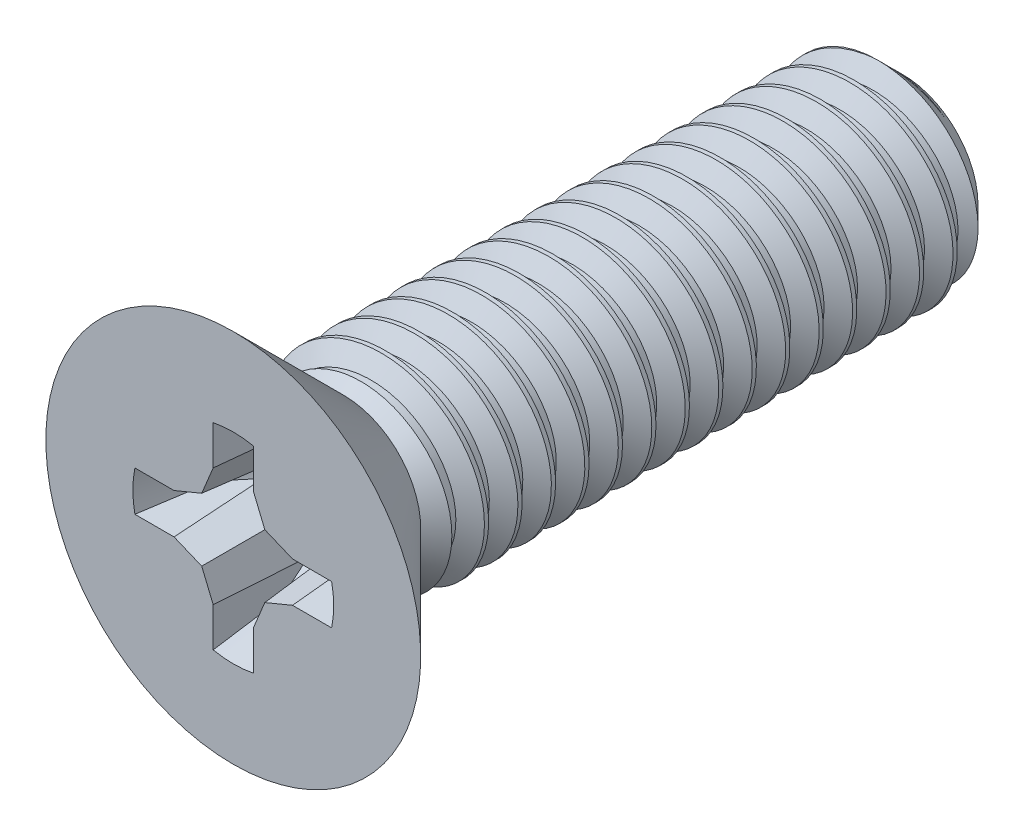
from build123d import *

# Parameters (mm, degrees)
HEAD_DIAMETER_SKETCH_R = 2.8
HEAD_EXTRUDE_DEPTH     = 1.65
SHAFT_SKETCH_W         = 8.35
SHAFT_SKETCH_H         = 1.5
THREAD_PITCH           = 0.5
DRIVE_CUT_REACH        = 12.755
DRIVE_PATTERN_COUNT    = 4
DRIVE_DRAFT_2_ANGLE    = 5


# Read off the part's stored shape, not the designer's step: Drive Draft 1
with BuildPart() as part:
    # Head Diameter Sketch → Head Extrude (new body)
    with BuildSketch(Plane.XY):
        Circle(HEAD_DIAMETER_SKETCH_R)
    extrude(amount=HEAD_EXTRUDE_DEPTH)

    # Shaft Sketch → Shaft Revolve (revolve)
    with BuildSketch(Plane(origin=(0, 0, 0), x_dir=(0, 0, -1), z_dir=(1, 0, 0)), mode=Mode.PRIVATE) as shaft_revolve_sk:
        with Locations((4.175, 0.75)):
            Rectangle(SHAFT_SKETCH_W, SHAFT_SKETCH_H)
    revolve(shaft_revolve_sk.sketch.rotate(Axis((0, 0, 0), (0, 0, -1)), 90), axis=Axis((0, 0, 0), (0, 0, -1)))

    # Head Cut Sketch → Head Cut (revolve, cut)
    with BuildSketch(Plane(origin=(0, 0, 0), x_dir=(0, 0, -1), z_dir=(1, 0, 0))):
        Polygon((0, 1.15), (-1.65, 2.8), (1.65, 2.8), align=None)
    revolve(axis=Axis((0, 0, -8.35), (0, 0, 1)), mode=Mode.SUBTRACT)

    # Thread: the profile of Thread Profile profile screwed along a right-hand helix of 16.5 turns, 6 arcs to a turn; built about Z, then put on its axis
    thread_z = Axis((0, 0, 0), (0, 0, 1))
    thread_corners = [(1.5003, 0, -0.000173205), (1.5003, 0, 0.437673204), (1.229367062, 0, 0.281249999), (1.229367062, 0, 0.156249999)]
    with BuildLine(mode=Mode.PRIVATE) as thread_profile:
        Line(thread_corners[0], thread_corners[1])
        Line(thread_corners[1], thread_corners[2])
        Line(thread_corners[2], thread_corners[3])
        Line(thread_corners[3], thread_corners[0])
    thread_cap = Face(thread_profile.wire())
    thread_turn_angles = [0, 30, 60, 90, 120, 150, 180, 210, 240, 270, 300, 330, 360]
    thread_turn_weights = [1, 0.8660254037844387, 1, 0.8660254037844387, 1, 0.8660254037844387, 1, 0.8660254037844387, 1, 0.8660254037844387, 1, 0.8660254037844387, 1]
    thread_turn_rails = [Edge.make_bspline([Vector(p[0], p[1], 0).rotate(thread_z, thread_turn_angles[k]) / thread_turn_weights[k] + Vector(0, 0, p[2] + THREAD_PITCH * thread_turn_angles[k] / 360) for k in range(13)], [0, 0, 0, 1, 1, 2, 2, 3, 3, 4, 4, 5, 5, 6, 6, 6], 2, thread_turn_weights) for p in thread_corners]
    thread_turn_sides = [Face.make_surface_from_curves(thread_turn_rails[p[0]], thread_turn_rails[p[1]]) for p in [(0, 1), (1, 2), (2, 3), (3, 0)]]
    thread_last_angles = [5760, 5790, 5820, 5850, 5880, 5910, 5940]
    thread_last_weights = [1, 0.8660254037844387, 1, 0.8660254037844387, 1, 0.8660254037844546, 1]
    thread_last_rails = [Edge.make_bspline([Vector(p[0], p[1], 0).rotate(thread_z, thread_last_angles[k]) / thread_last_weights[k] + Vector(0, 0, p[2] + THREAD_PITCH * thread_last_angles[k] / 360) for k in range(7)], [0, 0, 0, 1, 1, 2, 2, 3, 3, 3], 2, thread_last_weights) for p in thread_corners]
    thread_last_sides = [Face.make_surface_from_curves(thread_last_rails[p[0]], thread_last_rails[p[1]]) for p in [(0, 1), (1, 2), (2, 3), (3, 0)]]
    thread = Plane(origin=(0, 0, -8.6), x_dir=(1, 0, 0), z_dir=(0, 0, 1)) * Solid(Shell([*[p.moved(Location((0, 0, THREAD_PITCH * i))) for i in range(16) for p in thread_turn_sides], *thread_last_sides, thread_cap, thread_cap.rotate(thread_z, 5940).moved(Location((0, 0, THREAD_PITCH * 5940 / 360)))]))
    add(thread, mode=Mode.SUBTRACT)

    # Tip Chamfer Sketch → Tip Chamfer Cut (revolve, cut)
    with BuildSketch(Plane(origin=(0, 0, 0), x_dir=(0, 0, -1), z_dir=(1, 0, 0)), mode=Mode.PRIVATE) as tip_chamfer_cut_sk:
        Polygon((7.975, 1.5), (8.725, 1.5), (8.35, 1.125), align=None)
    revolve(tip_chamfer_cut_sk.sketch.rotate(Axis((0, 0, 0), (0, 0, -1)), 90), axis=Axis((0, 0, 0), (0, 0, -1)), mode=Mode.SUBTRACT)

    # Drive Cut: up to this cone (the profile starts inside it)
    drive_cut_end = Plane(origin=(0, 0, 1.65), z_dir=(0, 0, 1)).offset(-2.187173123) * Cone(1e-06, 17.629348246, 17.629347246, align=(Align.CENTER, Align.CENTER, Align.MIN), mode=Mode.PRIVATE)
    # Drive Cut Sketch → Drive Cut (cut, up to the surface)
    with BuildSketch(Plane.XY.offset(1.65), mode=Mode.PRIVATE) as drive_cut_sk1:
        with BuildLine():
            Line((1.469693846, 0.3), (0.884846923, 0.3))
            Line((0.884846923, 0.3), (0.471297698, 0.471297698))
            Line((0.471297698, 0.471297698), (0.3, 0.884846923))
            Line((0.3, 0.884846923), (0.3, 1.469693846))
            ThreePointArc((0.3, 1.469693846), (0.150763443, 1.49240423), (0, 1.5))
            Line((0, 1.5), (0, 0))
            Line((0, 0), (1.5, 0))
            ThreePointArc((1.5, 0), (1.49240423, 0.150763443), (1.469693846, 0.3))
        make_face()
    drive_cut_tool1 = extrude(drive_cut_sk1.sketch, amount=-DRIVE_CUT_REACH, mode=Mode.PRIVATE) & drive_cut_end
    drive_cut = drive_cut_tool1.solids().sort_by_distance((1.471298, 0.148631, 1.65))[0]
    add(drive_cut, mode=Mode.SUBTRACT)

    # Drive Pattern: Drive Cut ×4 about axis
    drive_pattern_axis = Axis((0, 0, 0), (0, 0, 1))
    for i in range(1, DRIVE_PATTERN_COUNT):
        add(drive_cut.rotate(drive_pattern_axis, i * 360 / DRIVE_PATTERN_COUNT), mode=Mode.SUBTRACT)

    # Drive Draft 1 outline → Drive Draft 1 (revolve)
    with BuildSketch(Plane.XZ):
        Polygon((1.5, 1.65), (1.248476814, 0.711302691), (1.5, 0.711302691), align=None)
    revolve(axis=Axis((0, 0, 0), (0, 0, 1)))

    # Drive Draft 2
    drive_draft_2_faces = [part.faces().sort_by_distance(p)[0] for p in [
        (0.3, 1.105559313, 1.158361155),
        (0.388407115, 0.671413266, 0.947624923),
        (0.671413266, 0.388407115, 0.947624923),
        (1.105559313, 0.3, 1.158361155),
        (1.105559313, -0.3, 1.158361155),
        (0.671413266, -0.388407115, 0.947624923),
        (0.388407115, -0.671413266, 0.947624923),
        (0.3, -1.105559313, 1.158361155),
        (-0.3, -1.105559313, 1.158361155),
        (-0.388407115, -0.671413266, 0.947624923),
        (-0.671413266, -0.388407115, 0.947624923),
        (-1.105559313, -0.3, 1.158361155),
        (-1.105559313, 0.3, 1.158361155),
        (-0.671413266, 0.388407115, 0.947624923),
        (-0.388407115, 0.671413266, 0.947624923),
        (-0.3, 1.105559313, 1.158361155),
    ]]
    draft(drive_draft_2_faces, Plane.XY.offset(1.65), DRIVE_DRAFT_2_ANGLE)


solid = part.part
